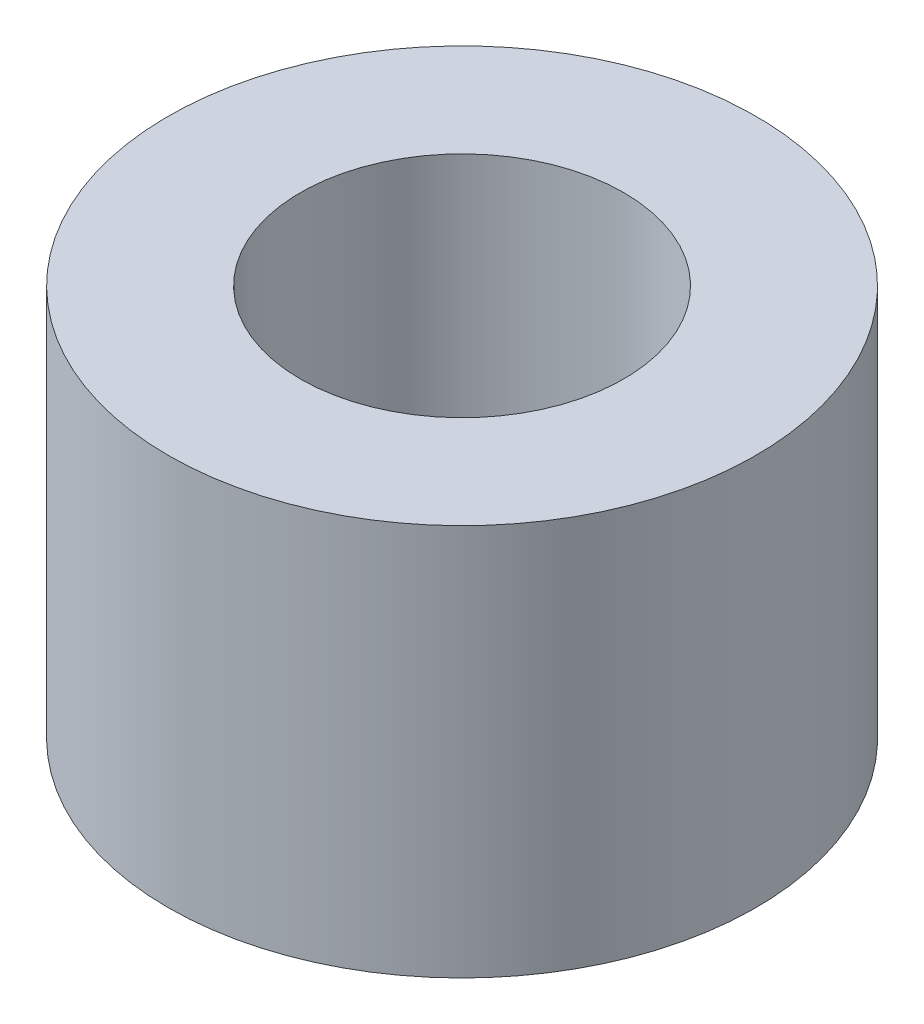
from build123d import *

# Parameters (mm, degrees)
SKETCH1_R             = 3
BOSS_EXTRUDE1_DEPTH   = 4
M4X0_7_TAPPED_HOLE1_D = 3.3


with BuildPart() as part:
    # Sketch1 → Boss-Extrude1 (new body)
    with BuildSketch(Plane(origin=(0, 0, 0), x_dir=(1, 0, 0), z_dir=(0, 1, 0))):
        Circle(SKETCH1_R)
    extrude(amount=BOSS_EXTRUDE1_DEPTH)

    # M4x0.7 Tapped Hole1 (through all)
    with Locations(Plane(origin=(0, 4, 0), x_dir=(1, 0, 0), z_dir=(0, 1, 0))):
        with Locations((0, 0)):
            Hole(M4X0_7_TAPPED_HOLE1_D / 2)


solid = part.part
